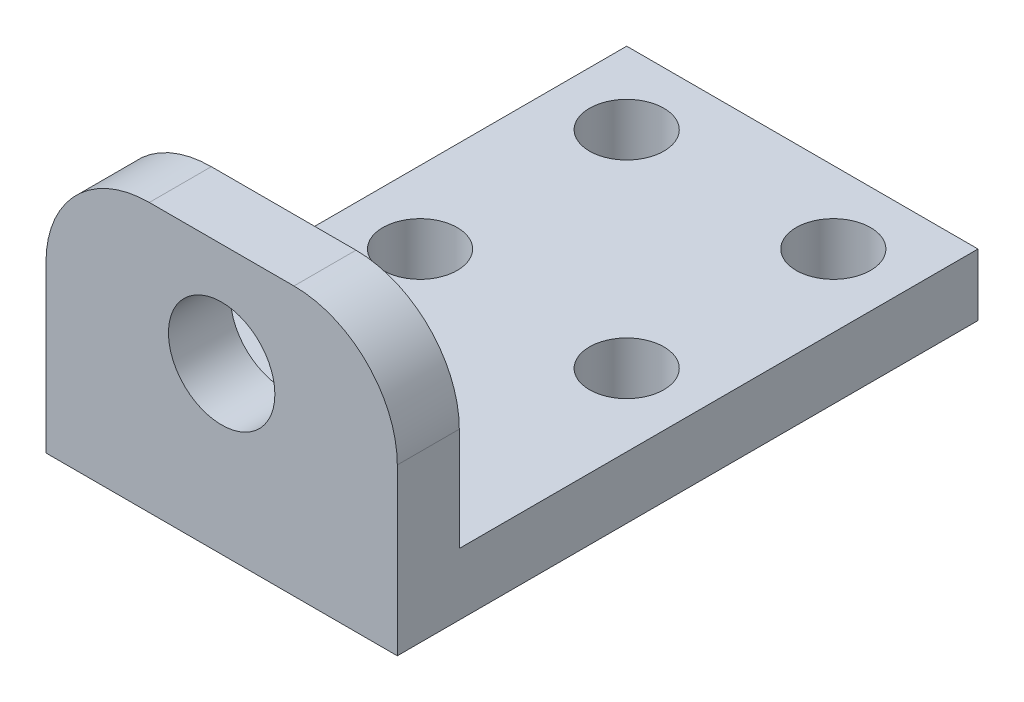
from build123d import *

# Parameters (mm, degrees)
BOSS_EXTRUDE1_DEPTH       = 17
F_5_0MM_DOWEL_HOLE1_D     = 5.15
F_5_0MM_DOWEL_HOLE1_DEPTH = 3
F_5_0MM_DOWEL_HOLE1_TIP   = 1.547216094
FILLET1_R                 = 5
M3_CLEARANCE_HOLE1_D      = 3.6


with BuildPart() as part:
    # Sketch1 → Boss-Extrude1 (new body)
    with BuildSketch(Plane(origin=(0, 0, 0), x_dir=(0, 0, -1), z_dir=(1, 0, 0))):
        Polygon((0, 0), (28.1, 0), (28.1, 3), (3, 3), (3, 13), (0, 13), align=None)
    extrude(amount=BOSS_EXTRUDE1_DEPTH)

    # Ø5.0mm Dowel Hole1
    with Locations(Plane.XY):
        with Locations((8.5, 8)):
            Hole(F_5_0MM_DOWEL_HOLE1_D / 2, depth=F_5_0MM_DOWEL_HOLE1_DEPTH)
            with Locations((0, 0, -(F_5_0MM_DOWEL_HOLE1_DEPTH + F_5_0MM_DOWEL_HOLE1_TIP / 2))):  # 118° drill point
                Cone(0, F_5_0MM_DOWEL_HOLE1_D / 2, F_5_0MM_DOWEL_HOLE1_TIP, mode=Mode.SUBTRACT)

    # Fillet1
    fillet1_edges = [part.edges().sort_by_distance(p)[0] for p in [
        (0, 13, -1.5),
        (17, 13, -1.5),
    ]]
    fillet(fillet1_edges, radius=FILLET1_R)

    # M3 Clearance Hole1 (through all)
    with Locations(Plane(origin=(0, 3, 0), x_dir=(1, 0, 0), z_dir=(0, 1, 0))):
        with Locations((13.5, 24.6), (3.5, 24.6), (3.5, 14.6), (13.5, 14.6)):
            Hole(M3_CLEARANCE_HOLE1_D / 2)


solid = part.part
